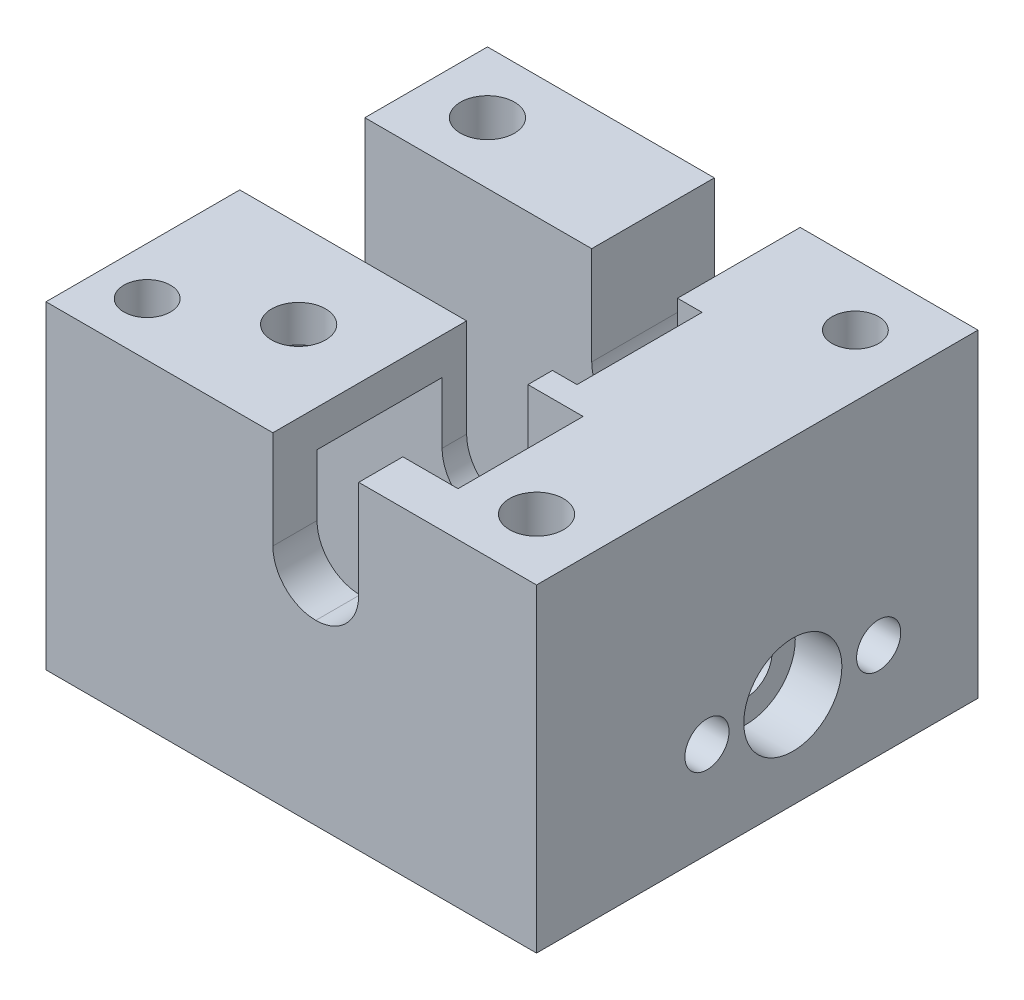
from build123d import *

# Parameters (mm, degrees)
SKETCH1_W           = 20
SKETCH1_H           = 18
BOSS_EXTRUDE1_DEPTH = 13
SKETCH7_W           = 3.5
SKETCH7_H           = 5.75
CUT_EXTRUDE6_DEPTH  = 25.351591324
SKETCH2_W           = 5.1
SKETCH2_H           = 11.1
CUT_EXTRUDE1_DEPTH  = 13.75
SKETCH3_R           = 1.05
CUT_EXTRUDE2_DEPTH  = 21.953818268
SKETCH4_R           = 2
CUT_EXTRUDE3_DEPTH  = 1.9
SKETCH11_R          = 0.9
CUT_EXTRUDE9_DEPTH  = 3
SKETCH5_W           = 11.1
SKETCH5_H           = 5.1
CUT_EXTRUDE4_DEPTH  = 19.708286934
SKETCH8_W           = 5.35
SKETCH8_H           = 5.1
SKETCH8_R           = 1.1
BOSS_EXTRUDE2_DEPTH = 1.5
SKETCH10_R          = 0.95
CUT_EXTRUDE8_DEPTH  = 6
SKETCH14_R          = 1.1
CUT_EXTRUDE11_DEPTH = 19.708286934
FILLET2_R           = 1.75
CHAMFER1_SIZE       = 0.5


with BuildPart() as part:
    # Sketch1 → Boss-Extrude1 (new body)
    with BuildSketch(Plane(origin=(0, 0, 0), x_dir=(1, 0, 0), z_dir=(0, 1, 0))):
        Rectangle(SKETCH1_W, SKETCH1_H)
    extrude(amount=BOSS_EXTRUDE1_DEPTH)

    # Sketch7 → Cut-Extrude6 (cut, through all)
    with BuildSketch(Plane.XY.offset(9)):
        with Locations((1, 10.125)):
            Rectangle(SKETCH7_W, SKETCH7_H)
    extrude(amount=-CUT_EXTRUDE6_DEPTH, mode=Mode.SUBTRACT)

    # Sketch2 → Cut-Extrude1 (cut)
    with BuildSketch(Plane.ZY.offset(10)):
        with Locations((-1.45, 7.45)):
            Rectangle(SKETCH2_W, SKETCH2_H)
    extrude(amount=-CUT_EXTRUDE1_DEPTH, mode=Mode.SUBTRACT)

    # Sketch3 → Cut-Extrude2 (cut, through all)
    with BuildSketch(Plane.ZY.offset(-3.75)):
        with Locations((-1.45, 3.9)):
            Circle(SKETCH3_R)
    extrude(amount=-CUT_EXTRUDE2_DEPTH, mode=Mode.SUBTRACT)

    # Sketch4 → Cut-Extrude3 (cut)
    with BuildSketch(Plane(origin=(10, 0, 0), x_dir=(0, 0, -1), z_dir=(1, 0, 0))):
        with Locations((1.45, 3.9)):
            Circle(SKETCH4_R)
    extrude(amount=-CUT_EXTRUDE3_DEPTH, mode=Mode.SUBTRACT)

    # Sketch11 → Cut-Extrude9 (cut)
    with BuildSketch(Plane(origin=(10, 0, 0), x_dir=(0, 0, -1), z_dir=(1, 0, 0))):
        with Locations((4.95, 3.9)):
            Circle(SKETCH11_R)
        with Locations(Location((-2.05, 3.9, 0), (0, 0, 180))):
            Circle(SKETCH11_R)
    extrude(amount=-CUT_EXTRUDE9_DEPTH, mode=Mode.SUBTRACT)

    # Sketch5 → Cut-Extrude4 (cut, through all)
    with BuildSketch(Plane(origin=(0, 13, 0), x_dir=(1, 0, 0), z_dir=(0, 1, 0))):
        with Locations((-0.55, -4.65)):
            Rectangle(SKETCH5_W, SKETCH5_H)
    extrude(amount=-CUT_EXTRUDE4_DEPTH, mode=Mode.SUBTRACT)

    # Sketch8 → Boss-Extrude2 (add)
    with BuildSketch(Plane(origin=(0, 13, 0), x_dir=(1, 0, 0), z_dir=(0, 1, 0))):
        with Locations((-3.425, -4.65)):
            Rectangle(SKETCH8_W, SKETCH8_H)
        with Locations(Location((-4.05, -4.65, 0), (0, 0, 270))):
            Circle(SKETCH8_R, mode=Mode.SUBTRACT)
    extrude(amount=-BOSS_EXTRUDE2_DEPTH)

    # Sketch10 → Cut-Extrude8 (cut)
    with BuildSketch(Plane(origin=(0, 13, 0), x_dir=(1, 0, 0), z_dir=(0, 1, 0))):
        with Locations(Location((-8.05, -6.825, 0), (0, 0, 270))):
            Circle(SKETCH10_R)
        with Locations(Location((7.5, 6.5, 0), (0, 0, 270))):
            Circle(SKETCH10_R)
    extrude(amount=-CUT_EXTRUDE8_DEPTH, mode=Mode.SUBTRACT)

    # Sketch14 → Cut-Extrude11 (cut, through all)
    with BuildSketch(Plane(origin=(0, 13, 0), x_dir=(1, 0, 0), z_dir=(0, 1, 0))):
        with Locations(Location((-7.5, 6.5, 0), (0, 0, 270))):
            Circle(SKETCH14_R)
        with Locations(Location((7.5, -6.5, 0), (0, 0, 270))):
            Circle(SKETCH14_R)
    extrude(amount=-CUT_EXTRUDE11_DEPTH, mode=Mode.SUBTRACT)

    # Fillet2
    fillet2_edges = [part.edges().sort_by_distance(p)[0] for p in [
        (2.75, 7.25, 8.1),
        (2.75, 7.25, 1.6),
        (-0.75, 7.25, 8.1),
        (-0.75, 7.25, 1.6),
        (2.75, 7.25, -6.5),
        (-0.75, 7.25, -6.5),
    ]]
    fillet(fillet2_edges, radius=FILLET2_R - 0.0001)  # a hair under: the kernel refuses the full size

    # Chamfer1
    chamfer1_edges = [part.edges().sort_by_distance(p)[0] for p in [
        (-0.55, 0, 2.1),
        (-0.55, 0, 7.2),
        (-6.1, 0, 4.65),
        (5, 0, 4.65),
    ]]
    chamfer(chamfer1_edges, length=CHAMFER1_SIZE)


solid = part.part
